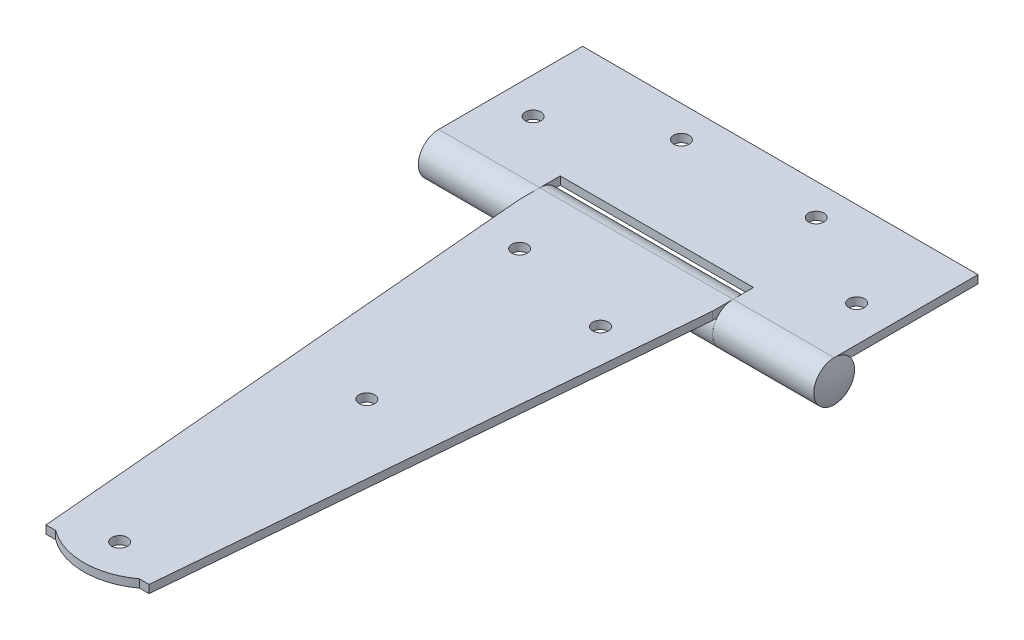
from build123d import *

# Parameters (mm, degrees)
EXTRUDE1_DEPTH        = 34.13125
EXTRUDE2_DEPTH        = 69.85
SKETCH6_W             = 68.2625
SKETCH6_H             = 14.4272
CUT_EXTRUDE3_DEPTH    = 208.881241352
CUT_EXTRUDE4_DEPTH    = 1056.132
A24_HOLES_R           = 2.7432
A24_HOLE_CUT_DEPTH    = 209.284321077
SKETCH10_R            = 2.7432
EXTRUDE3_DEPTH        = 209.284321077
SKETCH12_R            = 2.7432
EXTRUDE5_DEPTH        = 209.284321077
DELETEFACE1_START     = 11.5824
DELETEFACE1_OUTLINE_R = 2.7432
DELETEFACE1_DEPTH     = 2.8448


# Read off the part's stored shape, not the designer's step: DeleteFace1
with BuildPart() as part:
    # Sketch2 → Extrude1 (new, symmetric)
    with BuildSketch(Plane(origin=(0, 0, 0), x_dir=(0, 0, -1), z_dir=(1, 0, 0))):
        with BuildLine():
            Line((0, 14.4272), (-195.2625, 14.4272))
            Line((-195.2625, 14.4272), (-195.2625, 11.5824))
            Line((-195.2625, 11.5824), (0, 11.5824))
            Line((0, 11.5824), (0, 2.847975))
            ThreePointArc((0, 2.847975), (-3.868474062, 5.190337765), (-3.58571223, 9.70385088))
            Line((-3.58571223, 9.70385088), (-5.924900499, 11.3284))
            ThreePointArc((-5.924900499, 11.3284), (3.343164944, 0.821474131), (0, 14.4272))
        make_face()
    extrude(amount=EXTRUDE1_DEPTH, both=True)

    # Sketch8 → Cut-Extrude4 (cut)
    with BuildSketch(Plane.XZ.offset(-11.5824)):
        with BuildLine():
            Line((-18.203333333, 190.3809375), (-14.790208333, 190.3809375))
            ThreePointArc((-14.790208333, 190.3809375), (0, 195.2625), (14.790208333, 190.3809375))
            Line((14.790208333, 190.3809375), (18.203333333, 190.3809375))
            Line((18.203333333, 190.3809375), (34.13125, 7.2136))
            Line((34.13125, 7.2136), (73.025, 7.2136))
            Line((73.025, 7.2136), (73.025, 220.6625))
            Line((73.025, 220.6625), (-73.025, 220.6625))
            Line((-73.025, 220.6625), (-73.025, 7.2136))
            Line((-73.025, 7.2136), (-34.13125, 7.2136))
            Line((-34.13125, 7.2136), (-18.203333333, 190.3809375))
        make_face()
    extrude(amount=-CUT_EXTRUDE4_DEPTH, mode=Mode.SUBTRACT)


with BuildPart() as body_2:
    # Sketch4 → Extrude2 (new, symmetric)
    with BuildSketch(Plane(origin=(0, 0, 0), x_dir=(0, 0, -1), z_dir=(1, 0, 0))):
        with BuildLine():
            Line((0, 14.4272), (50.8, 14.4272))
            Line((50.8, 14.4272), (50.8, 11.5824))
            Line((50.8, 11.5824), (0, 11.5824))
            Line((0, 11.5824), (0, 11.579225))
            ThreePointArc((0, 11.579225), (-2.023262235, 3.345125938), (3.58571223, 9.70385088))
            Line((3.58571223, 9.70385088), (5.924900499, 11.3284))
            ThreePointArc((5.924900499, 11.3284), (-3.343164944, 0.821474131), (0, 14.4272))
        make_face()
    extrude(amount=EXTRUDE2_DEPTH, both=True)

    # Sketch6 → Cut-Extrude3 (cut, through all)
    with BuildSketch(Plane(origin=(0, 0, 0), x_dir=(1, 0, 0), z_dir=(0, 1, 0))):
        Rectangle(SKETCH6_W, SKETCH6_H)
    extrude(amount=CUT_EXTRUDE3_DEPTH, mode=Mode.SUBTRACT)


with BuildPart() as body_3:
    # Sketch7 → Revolve1 (revolve)
    with BuildSketch(Plane(origin=(0, 7.2136, 0), x_dir=(-1, 0, 0), z_dir=(0, 1, 0))):
        with BuildLine():
            Line((-71.040625, 0), (71.040625, 0))
            ThreePointArc((71.040625, 0), (70.740968682, -3.655598886), (69.85, -7.2136))
            Line((69.85, -7.2136), (69.85, -4.365625))
            Line((69.85, -4.365625), (-69.85, -4.365625))
            Line((-69.85, -4.365625), (-69.85, -7.2136))
            ThreePointArc((-69.85, -7.2136), (-70.740968682, -3.655598886), (-71.040625, 0))
        make_face()
    revolve(axis=Axis((71.040625, 7.2136, 0), (-1, 0, 0)))


with BuildPart() as a24_hole_cut_tool:
    # a24 holes → A24 hole cut (new, through all)
    with BuildSketch(Plane.XZ.offset(-14.4272)):
        with Locations(Location((0, 95.25, 0), (0, 0, 90))):
            Circle(A24_HOLES_R)
        with Locations(Location((-19.05, 22.225, 0), (0, 0, 90))):
            Circle(A24_HOLES_R)
        with Locations(Location((19.05, 31.75, 0), (0, 0, 90))):
            Circle(A24_HOLES_R)
        with Locations(Location((0, -39.6875, 0), (0, 0, 90))):
            Circle(A24_HOLES_R)
        with Locations(Location((57.15, -20.6375, 0), (0, 0, 90))):
            Circle(A24_HOLES_R)
        with Locations(Location((-57.15, -20.6375, 0), (0, 0, 90))):
            Circle(A24_HOLES_R)
    extrude(amount=A24_HOLE_CUT_DEPTH)


with BuildPart() as part_1:
    add(part.part)

    # A24 hole cut: cut by a24_hole_cut_tool
    add(a24_hole_cut_tool.part, mode=Mode.SUBTRACT)

    # Sketch10 → Extrude3 (cut, through all)
    with BuildSketch(Plane(origin=(0, 14.4272, 0), x_dir=(1, 0, 0), z_dir=(0, 1, 0))):
        with Locations(Location((0, -182.5625, 0), (0, 0, 270))):
            Circle(SKETCH10_R)
    extrude(amount=-EXTRUDE3_DEPTH, mode=Mode.SUBTRACT)


with BuildPart() as body_2_1:
    add(body_2.part)

    # A24 hole cut: cut by a24_hole_cut_tool
    add(a24_hole_cut_tool.part, mode=Mode.SUBTRACT)

    # Sketch12 → Extrude5 (cut, through all)
    with BuildSketch(Plane(origin=(0, 14.4272, 0), x_dir=(1, 0, 0), z_dir=(0, 1, 0))):
        with Locations(Location((-23.8125, 39.6875, 0), (0, 0, 270))):
            Circle(SKETCH12_R)
        with Locations(Location((23.8125, 39.6875, 0), (0, 0, 270))):
            Circle(SKETCH12_R)
    extrude(amount=-EXTRUDE5_DEPTH, mode=Mode.SUBTRACT)

    # DeleteFace1 outline → DeleteFace1 (add)
    with BuildSketch(Plane(origin=(0, 0, 0), x_dir=(1, 0, 0), z_dir=(0, 1, 0)).offset(DELETEFACE1_START)):
        with Locations((0, 39.6875)):
            Circle(DELETEFACE1_OUTLINE_R)
    extrude(amount=DELETEFACE1_DEPTH)


solid = Compound([body_3.part, part_1.part, body_2_1.part])
